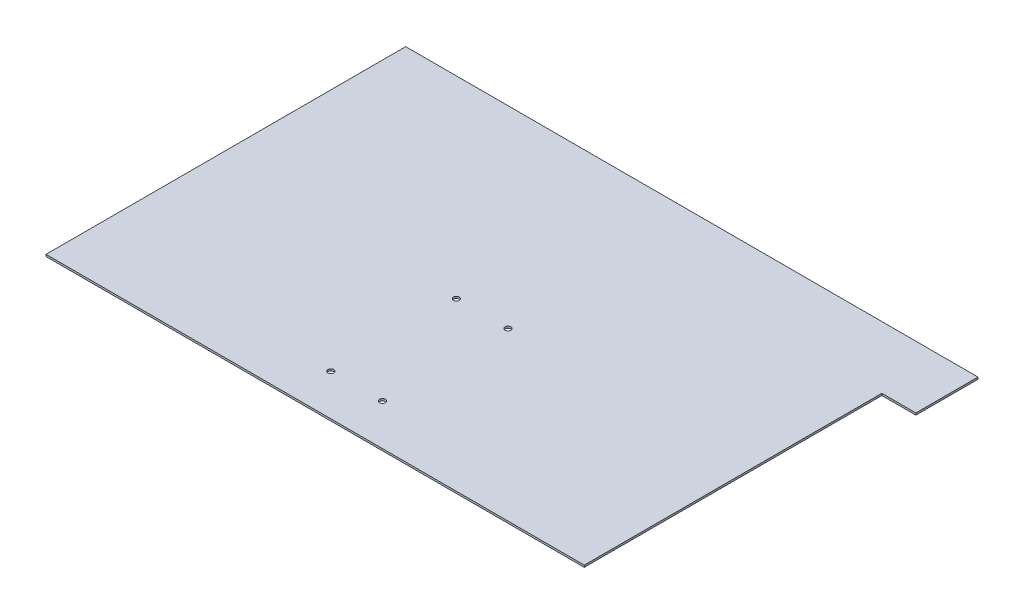
from build123d import *

# Parameters (mm, degrees)
SKETCH1_R          = 4.5
BASE_FLANGE1_DEPTH = 3


# Sheet-metal steps are written as plain solids
with BuildPart() as part:
    # Sketch1 → Base-Flange1 (new body)
    with BuildSketch(Plane(origin=(0, 0, 0), x_dir=(1, 0, 0), z_dir=(0, 1, 0))):
        Polygon((411.5, 275), (463.5, 275), (463.5, 180), (411.5, 180), (411.5, -275), (-411.5, -275), (-411.5, 275), align=None)
        with Locations(Location((-39, -212, 0), (0, 0, 90))):
            Circle(SKETCH1_R, mode=Mode.SUBTRACT)
        with Locations(Location((-39, -20, 0), (0, 0, 270))):
            Circle(SKETCH1_R, mode=Mode.SUBTRACT)
        with Locations(Location((40, -20, 0), (0, 0, 90))):
            Circle(SKETCH1_R, mode=Mode.SUBTRACT)
        with Locations(Location((40, -212, 0), (0, 0, 270))):
            Circle(SKETCH1_R, mode=Mode.SUBTRACT)
    extrude(amount=-BASE_FLANGE1_DEPTH)


solid = part.part
